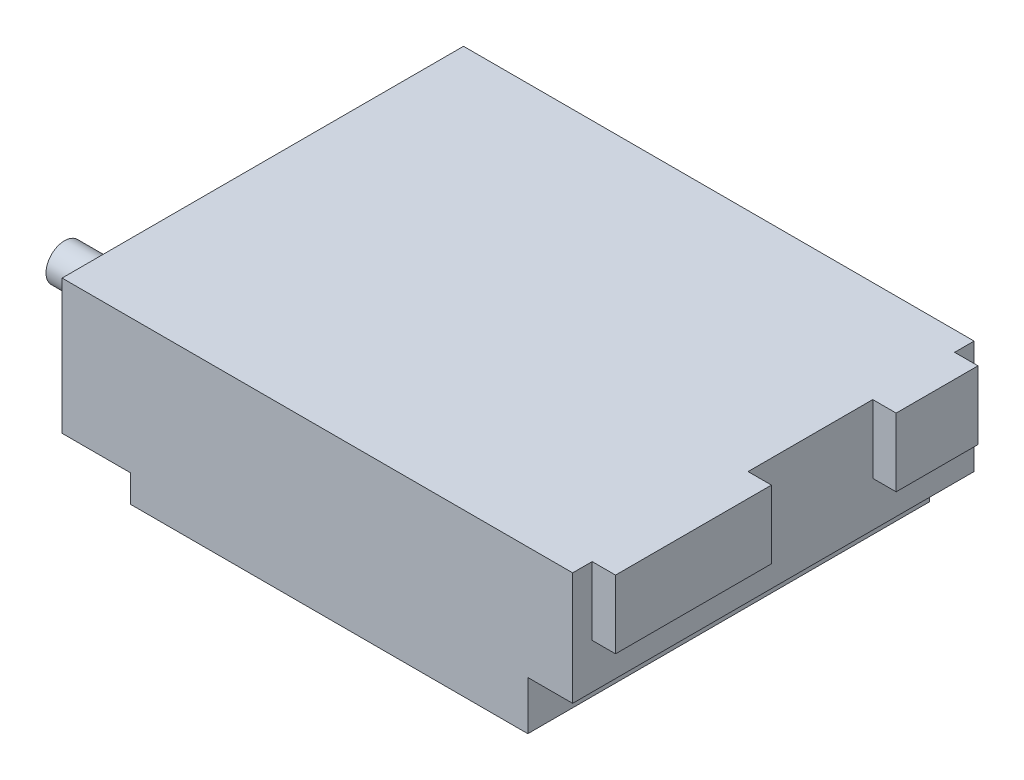
from build123d import *

# Parameters (mm, degrees)
SKETCH1_W           = 26.2
SKETCH1_H           = 20.6
BOSS_EXTRUDE1_DEPTH = 8.3
SKETCH2_W           = 8
SKETCH2_H           = 3.5
SKETCH2_W_2         = 4.2
BOSS_EXTRUDE2_DEPTH = 1.2
SKETCH3_R           = 0.95
BOSS_EXTRUDE3_DEPTH = 5
SKETCH4_W           = 2.3
SKETCH4_H           = 20.6
CUT_EXTRUDE1_DEPTH  = 2.5
SKETCH5_W           = 3.5
SKETCH5_H           = 20.6
CUT_EXTRUDE2_DEPTH  = 1.4


with BuildPart() as part:
    # Sketch1 → Boss-Extrude1 (new body)
    with BuildSketch(Plane(origin=(0, 0, 0), x_dir=(1, 0, 0), z_dir=(0, 1, 0))):
        Rectangle(SKETCH1_W, SKETCH1_H)
    extrude(amount=BOSS_EXTRUDE1_DEPTH)

    # Sketch2 → Boss-Extrude2 (add)
    with BuildSketch(Plane(origin=(13.1, 0, 0), x_dir=(0, 0, -1), z_dir=(1, 0, 0))):
        with Locations((-5.3, 6.55)):
            Rectangle(SKETCH2_W, SKETCH2_H)
        with Locations((7.2, 6.55)):
            Rectangle(SKETCH2_W_2, SKETCH2_H)
    extrude(amount=BOSS_EXTRUDE2_DEPTH)

    # Sketch3 → Boss-Extrude3 (add)
    with BuildSketch(Plane.ZY.offset(13.1)):
        with Locations((5.174837269, 3.945319614)):
            Circle(SKETCH3_R)
    extrude(amount=BOSS_EXTRUDE3_DEPTH)

    # Sketch4 → Cut-Extrude1 (cut)
    with BuildSketch(Plane.XZ):
        with Locations((11.95, 0)):
            Rectangle(SKETCH4_W, SKETCH4_H)
    extrude(amount=-CUT_EXTRUDE1_DEPTH, mode=Mode.SUBTRACT)

    # Sketch5 → Cut-Extrude2 (cut)
    with BuildSketch(Plane.XZ):
        with Locations((-11.35, 0)):
            Rectangle(SKETCH5_W, SKETCH5_H)
    extrude(amount=-CUT_EXTRUDE2_DEPTH, mode=Mode.SUBTRACT)


solid = part.part
